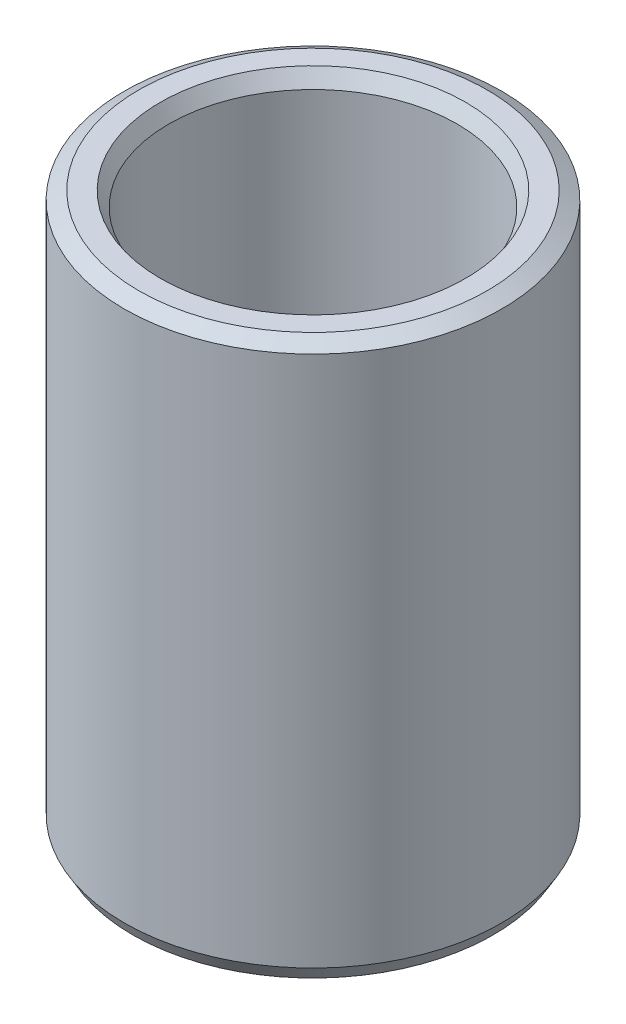
from build123d import *
from OCP.BRepFilletAPI import BRepFilletAPI_MakeChamfer

# Parameters (mm, degrees)
SKETCH1_R           = 25
BOSS_EXTRUDE1_DEPTH = 73.486217649
SKETCH2_R           = 19.098874789
CUT_EXTRUDE1_DEPTH  = 82.548906702
CHAMFER1_SIZE       = 1.118330728
CHAMFER1_SIZE2      = 1.937005641


with BuildPart() as part:
    # Sketch1 → Boss-Extrude1 (new body)
    with BuildSketch(Plane(origin=(0, 0, 0), x_dir=(1, 0, 0), z_dir=(0, 1, 0))):
        Circle(SKETCH1_R)
    extrude(amount=BOSS_EXTRUDE1_DEPTH)

    # Sketch2 → Cut-Extrude1 (cut, through all)
    with BuildSketch(Plane(origin=(0, 0, 0), x_dir=(1, 0, 0), z_dir=(0, 1, 0))):
        Circle(SKETCH2_R)
    extrude(amount=CUT_EXTRUDE1_DEPTH, mode=Mode.SUBTRACT)

    # Chamfer1: one chamfer whose edges measure the first distance from different faces: ONE call of the kernel's chamfer builder (chamfer() names one face for all edges)
    chamfer1_edges_1 = [part.edges().sort_by_distance(p)[0] for p in [
        (-19.098874789, 73.486217649, 0),
    ]]
    chamfer1_side_1 = [part.faces().sort_by_distance(p)[0] for p in [
        (-24.292893219, 73.486217649, 0),
    ]]
    chamfer1_edges_2 = [part.edges().sort_by_distance(p)[0] for p in [
        (-19.098874789, 0, 0),
    ]]
    chamfer1_side_2 = [part.faces().sort_by_distance(p)[0] for p in [
        (-19.098874789, 36.743108824, 0),
    ]]
    chamfer1_edges_3 = [part.edges().sort_by_distance(p)[0] for p in [
        (-25, 0, 0),
    ]]
    chamfer1_side_3 = [part.faces().sort_by_distance(p)[0] for p in [
        (-24.292893219, 0, 0),
    ]]
    chamfer1_edges_4 = [part.edges().sort_by_distance(p)[0] for p in [
        (-25, 73.486217649, 0),
    ]]
    chamfer1_side_4 = [part.faces().sort_by_distance(p)[0] for p in [
        (-25, 36.743108824, 0),
    ]]
    chamfer1 = BRepFilletAPI_MakeChamfer(part.part.solid().wrapped)
    for e in chamfer1_edges_1:
        chamfer1.Add(CHAMFER1_SIZE, CHAMFER1_SIZE2, e.wrapped, chamfer1_side_1[0].wrapped)  # the first distance lies on this face
    for e in chamfer1_edges_2:
        chamfer1.Add(CHAMFER1_SIZE, CHAMFER1_SIZE2, e.wrapped, chamfer1_side_2[0].wrapped)  # the first distance lies on this face
    for e in chamfer1_edges_3:
        chamfer1.Add(CHAMFER1_SIZE, CHAMFER1_SIZE2, e.wrapped, chamfer1_side_3[0].wrapped)  # the first distance lies on this face
    for e in chamfer1_edges_4:
        chamfer1.Add(CHAMFER1_SIZE, CHAMFER1_SIZE2, e.wrapped, chamfer1_side_4[0].wrapped)  # the first distance lies on this face
    add(Compound.cast(chamfer1.Shape()), mode=Mode.REPLACE)


solid = part.part
